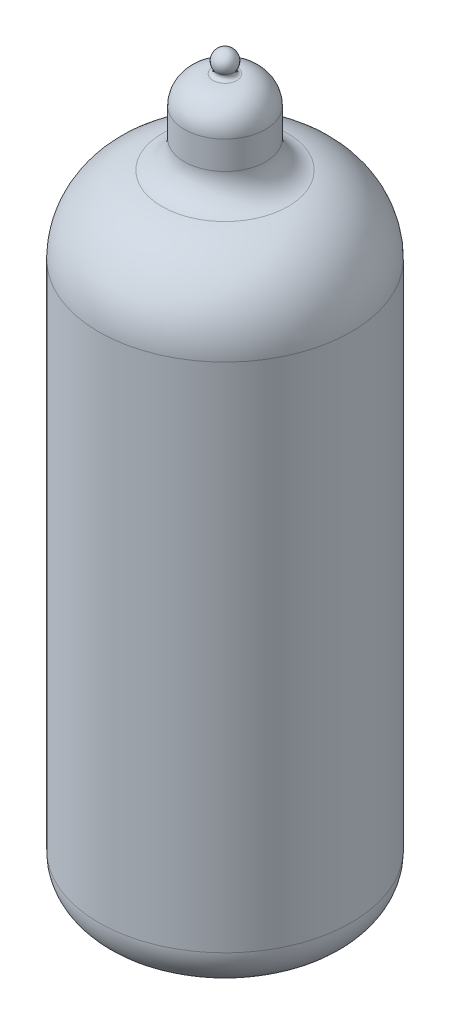
from build123d import *

# Parameters (mm, degrees)
CUT_EXTRUDE1_REACH = 56.021
SKETCH2_R          = 0.25
SKETCH3_R          = 3
CUT_EXTRUDE2_DEPTH = 0.5
CUT_EXTRUDE2_DRAFT = -15


with BuildPart() as part:
    # Sketch1 → Revolve1 (revolve)
    with BuildSketch(Plane.XY):
        with BuildLine():
            Line((0, -26.25), (-6, -26.25))
            ThreePointArc((-6, -26.25), (-8.121320344, -25.371320344), (-9, -23.25))
            Line((-9, -23.25), (-9, 13.25))
            ThreePointArc((-9, 13.25), (-7.73164929, 16.803167601), (-4.5, 18.75))
            ThreePointArc((-4.5, 18.75), (-3.348125006, 19.443920459), (-2.896039604, 20.71039604))
            Line((-2.896039604, 20.71039604), (-2.896039604, 22.71039604))
            ThreePointArc((-2.896039604, 22.71039604), (-2.293006224, 24.141648729), (-0.847555343, 24.709808272))
            ThreePointArc((-0.847555343, 24.709808272), (-0.623570884, 24.837222914), (-0.631121107, 25.094801101))
            ThreePointArc((-0.631121107, 25.094801101), (-0.658178993, 25.859583666), (0, 26.25))
            Line((0, 26.25), (0, 24.21039604))
            Line((0, 24.21039604), (-0.896039604, 24.21039604))
            ThreePointArc((-0.896039604, 24.21039604), (-1.956699776, 23.771056211), (-2.396039604, 22.71039604))
            Line((-2.396039604, 22.71039604), (-2.396039604, 20.71039604))
            ThreePointArc((-2.396039604, 20.71039604), (-2.961146356, 19.127301564), (-4.400990099, 18.25990099))
            ThreePointArc((-4.400990099, 18.25990099), (-7.34467064, 16.486548706), (-8.5, 13.25))
            Line((-8.5, 13.25), (-8.5, -21.25))
            ThreePointArc((-8.5, -21.25), (-8.207106781, -21.957106781), (-7.5, -22.25))
            Line((-7.5, -22.25), (0, -22.25))
            Line((0, -22.25), (0, -26.25))
        make_face()
    revolve(axis=Axis((0, 26.25, 0), (0, -1, 0)))

    # Sketch2 → Cut-Extrude1 (cut, up to next)
    with BuildSketch(Plane.XZ.offset(26.25), mode=Mode.PRIVATE) as cut_extrude1_sk1:
        with Locations((0, -5.75)):
            Circle(SKETCH2_R)
    cut_extrude1_tool1 = extrude(cut_extrude1_sk1.sketch, amount=-CUT_EXTRUDE1_REACH, mode=Mode.PRIVATE) & part.part
    # Sketch2 → Cut-Extrude1 (cut, up to next)
    with BuildSketch(Plane.XZ.offset(26.25), mode=Mode.PRIVATE) as cut_extrude1_sk2:
        with Locations((-2.672158239, -5.091372148)):
            Circle(SKETCH2_R)
    cut_extrude1_tool2 = extrude(cut_extrude1_sk2.sketch, amount=-CUT_EXTRUDE1_REACH, mode=Mode.PRIVATE) & part.part
    # Sketch2 → Cut-Extrude1 (cut, up to next)
    with BuildSketch(Plane.XZ.offset(26.25), mode=Mode.PRIVATE) as cut_extrude1_sk3:
        with Locations((-4.732157229, -3.266372294)):
            Circle(SKETCH2_R)
    cut_extrude1_tool3 = extrude(cut_extrude1_sk3.sketch, amount=-CUT_EXTRUDE1_REACH, mode=Mode.PRIVATE) & part.part
    # Sketch2 → Cut-Extrude1 (cut, up to next)
    with BuildSketch(Plane.XZ.offset(26.25), mode=Mode.PRIVATE) as cut_extrude1_sk4:
        with Locations((-5.708076026, -0.693085911)):
            Circle(SKETCH2_R)
    cut_extrude1_tool4 = extrude(cut_extrude1_sk4.sketch, amount=-CUT_EXTRUDE1_REACH, mode=Mode.PRIVATE) & part.part
    # Sketch2 → Cut-Extrude1 (cut, up to next)
    with BuildSketch(Plane.XZ.offset(26.25), mode=Mode.PRIVATE) as cut_extrude1_sk5:
        with Locations((-5.376343395, 2.0389781)):
            Circle(SKETCH2_R)
    cut_extrude1_tool5 = extrude(cut_extrude1_sk5.sketch, amount=-CUT_EXTRUDE1_REACH, mode=Mode.PRIVATE) & part.part
    # Sketch2 → Cut-Extrude1 (cut, up to next)
    with BuildSketch(Plane.XZ.offset(26.25), mode=Mode.PRIVATE) as cut_extrude1_sk6:
        with Locations((-3.812955285, 4.303936802)):
            Circle(SKETCH2_R)
    cut_extrude1_tool6 = extrude(cut_extrude1_sk6.sketch, amount=-CUT_EXTRUDE1_REACH, mode=Mode.PRIVATE) & part.part
    # Sketch2 → Cut-Extrude1 (cut, up to next)
    with BuildSketch(Plane.XZ.offset(26.25), mode=Mode.PRIVATE) as cut_extrude1_sk7:
        with Locations((-1.37606507, 5.58291545)):
            Circle(SKETCH2_R)
    cut_extrude1_tool7 = extrude(cut_extrude1_sk7.sketch, amount=-CUT_EXTRUDE1_REACH, mode=Mode.PRIVATE) & part.part
    # Sketch2 → Cut-Extrude1 (cut, up to next)
    with BuildSketch(Plane.XZ.offset(26.25), mode=Mode.PRIVATE) as cut_extrude1_sk8:
        with Locations((1.37606507, 5.58291545)):
            Circle(SKETCH2_R)
    cut_extrude1_tool8 = extrude(cut_extrude1_sk8.sketch, amount=-CUT_EXTRUDE1_REACH, mode=Mode.PRIVATE) & part.part
    # Sketch2 → Cut-Extrude1 (cut, up to next)
    with BuildSketch(Plane.XZ.offset(26.25), mode=Mode.PRIVATE) as cut_extrude1_sk9:
        with Locations((3.812955285, 4.303936802)):
            Circle(SKETCH2_R)
    cut_extrude1_tool9 = extrude(cut_extrude1_sk9.sketch, amount=-CUT_EXTRUDE1_REACH, mode=Mode.PRIVATE) & part.part
    # Sketch2 → Cut-Extrude1 (cut, up to next)
    with BuildSketch(Plane.XZ.offset(26.25), mode=Mode.PRIVATE) as cut_extrude1_sk10:
        with Locations((5.376343395, 2.0389781)):
            Circle(SKETCH2_R)
    cut_extrude1_tool10 = extrude(cut_extrude1_sk10.sketch, amount=-CUT_EXTRUDE1_REACH, mode=Mode.PRIVATE) & part.part
    # Sketch2 → Cut-Extrude1 (cut, up to next)
    with BuildSketch(Plane.XZ.offset(26.25), mode=Mode.PRIVATE) as cut_extrude1_sk11:
        with Locations((5.708076026, -0.693085911)):
            Circle(SKETCH2_R)
    cut_extrude1_tool11 = extrude(cut_extrude1_sk11.sketch, amount=-CUT_EXTRUDE1_REACH, mode=Mode.PRIVATE) & part.part
    # Sketch2 → Cut-Extrude1 (cut, up to next)
    with BuildSketch(Plane.XZ.offset(26.25), mode=Mode.PRIVATE) as cut_extrude1_sk12:
        with Locations((4.732157229, -3.266372294)):
            Circle(SKETCH2_R)
    cut_extrude1_tool12 = extrude(cut_extrude1_sk12.sketch, amount=-CUT_EXTRUDE1_REACH, mode=Mode.PRIVATE) & part.part
    # Sketch2 → Cut-Extrude1 (cut, up to next)
    with BuildSketch(Plane.XZ.offset(26.25), mode=Mode.PRIVATE) as cut_extrude1_sk13:
        with Locations((2.672158239, -5.091372148)):
            Circle(SKETCH2_R)
    cut_extrude1_tool13 = extrude(cut_extrude1_sk13.sketch, amount=-CUT_EXTRUDE1_REACH, mode=Mode.PRIVATE) & part.part
    add(cut_extrude1_tool1.solids().sort_by_distance((0, -26.25, -5.75))[0], mode=Mode.SUBTRACT)
    add(cut_extrude1_tool2.solids().sort_by_distance((-2.672158, -26.25, -5.091372))[0], mode=Mode.SUBTRACT)
    add(cut_extrude1_tool3.solids().sort_by_distance((-4.732157, -26.25, -3.266372))[0], mode=Mode.SUBTRACT)
    add(cut_extrude1_tool4.solids().sort_by_distance((-5.708076, -26.25, -0.693086))[0], mode=Mode.SUBTRACT)
    add(cut_extrude1_tool5.solids().sort_by_distance((-5.376343, -26.25, 2.038978))[0], mode=Mode.SUBTRACT)
    add(cut_extrude1_tool6.solids().sort_by_distance((-3.812955, -26.25, 4.303937))[0], mode=Mode.SUBTRACT)
    add(cut_extrude1_tool7.solids().sort_by_distance((-1.376065, -26.25, 5.582915))[0], mode=Mode.SUBTRACT)
    add(cut_extrude1_tool8.solids().sort_by_distance((1.376065, -26.25, 5.582915))[0], mode=Mode.SUBTRACT)
    add(cut_extrude1_tool9.solids().sort_by_distance((3.812955, -26.25, 4.303937))[0], mode=Mode.SUBTRACT)
    add(cut_extrude1_tool10.solids().sort_by_distance((5.376343, -26.25, 2.038978))[0], mode=Mode.SUBTRACT)
    add(cut_extrude1_tool11.solids().sort_by_distance((5.708076, -26.25, -0.693086))[0], mode=Mode.SUBTRACT)
    add(cut_extrude1_tool12.solids().sort_by_distance((4.732157, -26.25, -3.266372))[0], mode=Mode.SUBTRACT)
    add(cut_extrude1_tool13.solids().sort_by_distance((2.672158, -26.25, -5.091372))[0], mode=Mode.SUBTRACT)


with BuildPart() as cut_extrude2_tool:
    # Sketch3 → Cut-Extrude2 (with draft: the straight prism first)
    with BuildSketch(Plane.XZ.offset(26.25)):
        Circle(SKETCH3_R)
        Polygon((0.375, 2.5), (-0.375, 2.5), (-0.375, -0.75), (-0.75, -0.75), (0, -2.5), (0.75, -0.75), (0.375, -0.75), align=None, mode=Mode.SUBTRACT)
    extrude(amount=-CUT_EXTRUDE2_DEPTH)
    # Cut-Extrude2: the draft: its side faces are tilted about the plane it starts from
    cut_extrude2_sides = [cut_extrude2_tool.faces().sort_by_distance(p)[0] for p in [
        (-3, -26, 0),
        (0.375, -26, 0.875),
        (0.5625, -26, -0.75),
        (0.375, -26, -1.625),
        (-0.375, -26, -1.625),
        (-0.5625, -26, -0.75),
        (-0.375, -26, 0.875),
        (0, -26, 2.5),
    ]]
    draft(cut_extrude2_sides, Plane.XZ.offset(26.25), CUT_EXTRUDE2_DRAFT)


with BuildPart() as part_1:
    add(part.part)

    # Cut-Extrude2: cut by cut_extrude2_tool
    add(cut_extrude2_tool.part, mode=Mode.SUBTRACT)


solid = part_1.part
